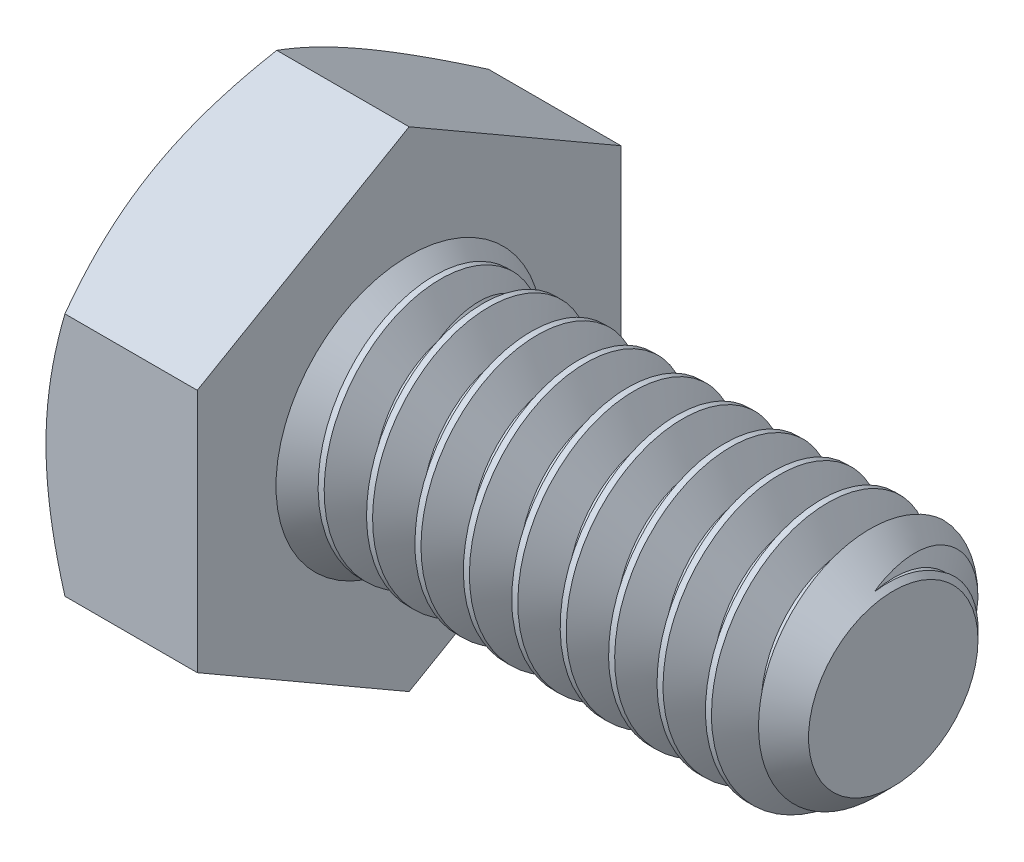
from build123d import *

# Parameters (mm, degrees)
SKETCH5_R           = 3.175
BOSS_EXTRUDE3_DEPTH = 12.7
CHAMFER1_SIZE       = 0.9525
BOSS_EXTRUDE4_DEPTH = 3.96875
SKETCH8_OUTSIDE_W   = 86.13
SKETCH8_OUTSIDE_H   = 87.85
SKETCH8_OUTSIDE_R   = 5.55625
CUT_EXTRUDE3_DEPTH  = 19.705124771
CUT_EXTRUDE3_DRAFT  = -60
CUT_SWEEP1_PITCH    = 1.27
CUT_SWEEP1_TO       = 12.7


with BuildPart() as part:
    # Sketch5 → Boss-Extrude3 (new body)
    with BuildSketch(Plane(origin=(8.334375, 0, 0), x_dir=(0, 0, -1), z_dir=(1, 0, 0))):
        Circle(SKETCH5_R)
    extrude(amount=-BOSS_EXTRUDE3_DEPTH)

    # Chamfer1
    chamfer1_edges = [part.edges().sort_by_distance(p)[0] for p in [
        (8.334375, 0, 3.175),
    ]]
    chamfer(chamfer1_edges, length=CHAMFER1_SIZE)

    # Sketch6 → Boss-Extrude4 (add)
    with BuildSketch(Plane.ZY.offset(4.365625)):
        Polygon((5.55625, 3.207902433), (0, 6.415804866), (-5.55625, 3.207902433), (-5.55625, -3.207902433), (0, -6.415804866), (5.55625, -3.207902433), align=None)
    extrude(amount=BOSS_EXTRUDE4_DEPTH)


with BuildPart() as cut_extrude3_tool:
    # Sketch8 outside → Cut-Extrude3 (with draft: the straight prism first)
    with BuildSketch(Plane.ZY.offset(8.334375)):
        Rectangle(SKETCH8_OUTSIDE_W, SKETCH8_OUTSIDE_H)
        Circle(SKETCH8_OUTSIDE_R, mode=Mode.SUBTRACT)
    extrude(amount=-CUT_EXTRUDE3_DEPTH)
    # Cut-Extrude3: the draft: its side faces are tilted about the plane it starts from
    cut_extrude3_sides = [cut_extrude3_tool.faces().sort_by_distance(p)[0] for p in [
        (1.518187386, -43.925, 0),
        (1.518187386, 0, 43.065),
        (1.518187386, 43.925, 0),
        (1.518187386, 0, -43.065),
        (1.518187386, 0, -5.55625),
    ]]
    draft(cut_extrude3_sides, Plane.ZY.offset(8.334375), CUT_EXTRUDE3_DRAFT)


with BuildPart() as part_1:
    add(part.part)

    # Cut-Extrude3: cut by cut_extrude3_tool
    add(cut_extrude3_tool.part, mode=Mode.SUBTRACT)


with BuildPart() as body_2:
    # Split1: read off the stored shape, not the designer's step
    # Split1: the piece on the far side of the plane
    add(part_1.part)
    split(bisect_by=Plane.YZ.offset(-4.365625), keep=Keep.BOTTOM)


with BuildPart() as part_2:
    add(part_1.part)

    # Split1
    split(bisect_by=Plane.YZ.offset(-4.365625), keep=Keep.TOP)

    # Cut-Sweep1: arcs per turn and ends read off the stored shape
    # Cut-Sweep1: the profile of Sketch10 screwed along a right-hand helix through 11 turns, 8 arcs to a turn; built about Z, then put on its axis
    cut_sweep1_z = Axis((0, 0, 0), (0, 0, 1))
    cut_sweep1_corners = [(2.350110803, 0, -0.635), (2.350110803, 0, -0.47625), (3.243740766, 0, 0.0396875), (3.243740766, 0, -1.1509375)]
    with BuildLine(mode=Mode.PRIVATE) as cut_sweep1_profile:
        Line(cut_sweep1_corners[0], cut_sweep1_corners[1])
        Line(cut_sweep1_corners[1], cut_sweep1_corners[2])
        Line(cut_sweep1_corners[2], cut_sweep1_corners[3])
        Line(cut_sweep1_corners[3], cut_sweep1_corners[0])
    cut_sweep1_cap = Face(cut_sweep1_profile.wire())
    cut_sweep1_turn_angles = [0, 22.5, 45, 67.5, 90, 112.5, 135, 157.5, 180, 202.5, 225, 247.5, 270, 292.5, 315, 337.5, 360]
    cut_sweep1_turn_weights = [1, 0.9238795325112867, 1, 0.9238795325112867, 1, 0.9238795325112867, 1, 0.9238795325112867, 1, 0.9238795325112867, 1, 0.9238795325112867, 1, 0.9238795325112867, 1, 0.9238795325112867, 1]
    cut_sweep1_turn_rails = [Edge.make_bspline([Vector(p[0], p[1], 0).rotate(cut_sweep1_z, cut_sweep1_turn_angles[k]) / cut_sweep1_turn_weights[k] + Vector(0, 0, p[2] + CUT_SWEEP1_PITCH * cut_sweep1_turn_angles[k] / 360) for k in range(17)], [0, 0, 0, 1, 1, 2, 2, 3, 3, 4, 4, 5, 5, 6, 6, 7, 7, 8, 8, 8], 2, cut_sweep1_turn_weights) for p in cut_sweep1_corners]
    cut_sweep1_turn_sides = [Face.make_surface_from_curves(cut_sweep1_turn_rails[p[0]], cut_sweep1_turn_rails[p[1]]) for p in [(0, 1), (1, 2), (2, 3), (3, 0)]]
    cut_sweep1 = Plane(origin=(8.334375, 0, 0), x_dir=(0, -1, 0), z_dir=(-1, 0, 0)) * split(Solid(Shell([*[p.moved(Location((0, 0, CUT_SWEEP1_PITCH * i))) for i in range(11) for p in cut_sweep1_turn_sides], cut_sweep1_cap, cut_sweep1_cap.rotate(cut_sweep1_z, 3960).moved(Location((0, 0, CUT_SWEEP1_PITCH * 3960 / 360)))])), bisect_by=Plane.XY.offset(CUT_SWEEP1_TO), keep=Keep.BOTTOM, mode=Mode.PRIVATE)
    add(cut_sweep1, mode=Mode.SUBTRACT)


with BuildPart() as body_2_1:
    add(body_2.part)

    # Combine1: union part
    add(part_2.part)

    # Boss-Extrude5 cone 1 section (through the dimple's axis) → Boss-Extrude5 (revolve)
    with BuildSketch(Plane(origin=(-4.365625, 0, 0), x_dir=(0, 0, 1), z_dir=(0, 1, 0))):
        Polygon((0, 0), (3.4925, 0), (0, 3.4925), align=None)
    revolve(axis=Axis((-4.365625, 0, 0), (1, 0, 0)))


solid = body_2_1.part
